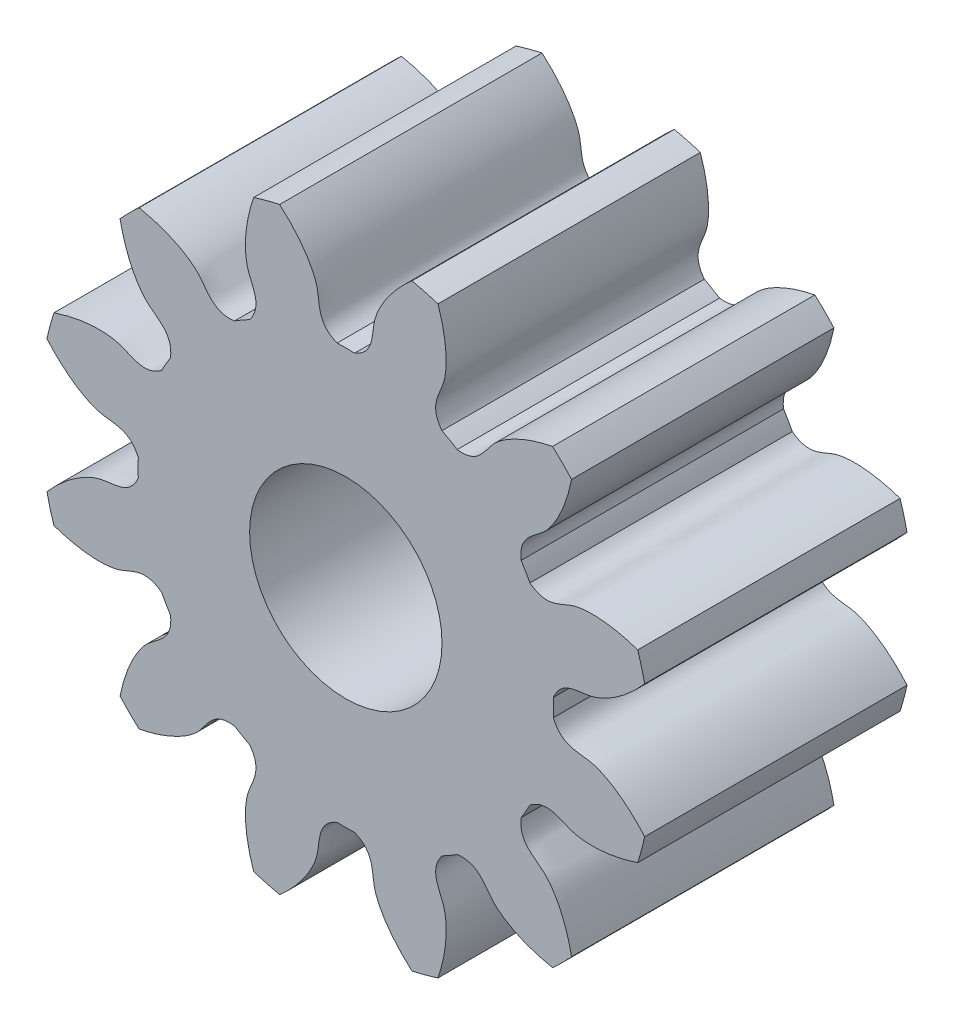
from build123d import *

# Parameters (mm, degrees)
SKETCH_1_R               = 3.5
EXTRUDE_1_DEPTH          = 3
CUT_EXTRUDE_1_DEPTH      = 6.787918451
PATTERN_CIRCULAR_1_COUNT = 12
CUT_EXTRUDE_2_REACH      = 7.688
SKETCH_5_R               = 1.1


with BuildPart() as part:
    # 草图1 → 凸台-拉伸1 (new body)
    with BuildSketch(Plane.XY):
        Circle(SKETCH_1_R)
    extrude(amount=EXTRUDE_1_DEPTH)

    # 草图2 → 切除-拉伸1 (cut, through all)
    with BuildSketch(Plane.XY):
        with BuildLine():
            ThreePointArc((0.100420056, 2.372876063), (0, 2.375), (-0.100420056, 2.372876063))
            add(Edge.make_bspline(
                [(-0.100420056, 2.372876063), (-0.340394435, 2.474653731), (-0.287186739, 2.672409341), (-0.338076094, 2.844740289), (-0.341311927, 2.854952869), (-0.345113625, 2.866166713), (-0.349521434, 2.878363044), (-0.354576313, 2.891521619), (-0.360318258, 2.905621034), (-0.36678678, 2.920638648), (-0.374020716, 2.936550626), (-0.382058239, 2.95333195), (-0.390936819, 2.970956436), (-0.400693193, 2.989396753), (-0.411363332, 3.008624444), (-0.422982412, 3.02860994), (-0.435584786, 3.049322589), (-0.449203949, 3.07073067), (-0.463872517, 3.092801417), (-0.479622192, 3.115501045), (-0.496483738, 3.138794769), (-0.514486952, 3.162646832), (-0.533660639, 3.187020528), (-0.554032585, 3.211878226), (-0.575629533, 3.237181399), (-0.598477155, 3.262890651), (-0.622600033, 3.288965742), (-0.648021632, 3.315365616), (-0.674764279, 3.342048434), (-0.702849139, 3.368971597), (-0.732296196, 3.396091781), (-0.763124233, 3.423364967), (-0.795350811, 3.450746465), (-0.828992247, 3.478190957), (-0.864063604, 3.505652518), (-0.900578664, 3.533084654), (-0.938549918, 3.560440334), (-0.977988547, 3.587672024), (-1.01890441, 3.614731718), (-1.061306025, 3.641570973), (-1.10520056, 3.668140947), (-1.150593819, 3.694392428), (-1.197490231, 3.720275872), (-1.245892835, 3.74574144), (-1.295803277, 3.770739031), (-1.347221796, 3.79521832), (-1.400147219, 3.819128792), (-1.454576948, 3.842419781), (-1.510506963, 3.865040505), (-1.567931802, 3.886940103), (-1.647189853, 3.915363979), (-1.7077968, 3.935050704), (-1.748802701, 3.947485455)],
                knots=[0, 0, 0, 0, 0.218015236, 0.222043642, 0.226545979, 0.231522246, 0.236972443, 0.24289657, 0.249294627, 0.256166614, 0.263512532, 0.271332379, 0.279626157, 0.288393865, 0.297635503, 0.307351072, 0.31754057, 0.328203999, 0.339341357, 0.350952646, 0.363037866, 0.375597015, 0.388630094, 0.402137104, 0.416118043, 0.430572913, 0.445501713, 0.460904444, 0.476781104, 0.493131694, 0.509956215, 0.527254666, 0.545027047, 0.563273358, 0.581993599, 0.601187771, 0.620855872, 0.640997904, 0.661613866, 0.682703758, 0.704267581, 0.726305333, 0.748817015, 0.771802628, 0.795262171, 0.819195644, 0.843603047, 0.868484381, 0.893839644, 0.919668838, 0.945971962, 1, 1, 1, 1], degree=3))
            ThreePointArc((-1.748802701, 3.947485455), (0, 4.317516914), (1.748802701, 3.947485455))
            add(Edge.make_bspline(
                [(0.100420056, 2.372876063), (0.340394435, 2.474653731), (0.287186739, 2.672409341), (0.338076094, 2.844740289), (0.341311927, 2.854952869), (0.345113625, 2.866166713), (0.349521434, 2.878363044), (0.354576313, 2.891521619), (0.360318258, 2.905621034), (0.36678678, 2.920638648), (0.374020716, 2.936550626), (0.382058239, 2.95333195), (0.390936819, 2.970956436), (0.400693193, 2.989396753), (0.411363332, 3.008624444), (0.422982412, 3.02860994), (0.435584786, 3.049322589), (0.449203949, 3.07073067), (0.463872517, 3.092801417), (0.479622192, 3.115501045), (0.496483738, 3.138794769), (0.514486952, 3.162646832), (0.533660639, 3.187020528), (0.554032585, 3.211878226), (0.575629533, 3.237181399), (0.598477155, 3.262890651), (0.622600033, 3.288965742), (0.648021632, 3.315365616), (0.674764279, 3.342048434), (0.702849139, 3.368971597), (0.732296196, 3.396091781), (0.763124233, 3.423364967), (0.795350811, 3.450746465), (0.828992247, 3.478190957), (0.864063604, 3.505652518), (0.900578664, 3.533084654), (0.938549918, 3.560440334), (0.977988547, 3.587672024), (1.01890441, 3.614731718), (1.061306025, 3.641570973), (1.10520056, 3.668140947), (1.150593819, 3.694392428), (1.197490231, 3.720275872), (1.245892835, 3.74574144), (1.295803277, 3.770739031), (1.347221796, 3.79521832), (1.400147219, 3.819128792), (1.454576948, 3.842419781), (1.510506963, 3.865040505), (1.567931802, 3.886940103), (1.647189853, 3.915363979), (1.7077968, 3.935050704), (1.748802701, 3.947485455)],
                knots=[0, 0, 0, 0, 0.218015236, 0.222043642, 0.226545979, 0.231522246, 0.236972443, 0.24289657, 0.249294627, 0.256166614, 0.263512532, 0.271332379, 0.279626157, 0.288393865, 0.297635503, 0.307351072, 0.31754057, 0.328203999, 0.339341357, 0.350952646, 0.363037866, 0.375597015, 0.388630094, 0.402137104, 0.416118043, 0.430572913, 0.445501713, 0.460904444, 0.476781104, 0.493131694, 0.509956215, 0.527254666, 0.545027047, 0.563273358, 0.581993599, 0.601187771, 0.620855872, 0.640997904, 0.661613866, 0.682703758, 0.704267581, 0.726305333, 0.748817015, 0.771802628, 0.795262171, 0.819195644, 0.843603047, 0.868484381, 0.893839644, 0.919668838, 0.945971962, 1, 1, 1, 1], degree=3))
        make_face()
    cut_extrude_1 = extrude(amount=CUT_EXTRUDE_1_DEPTH, mode=Mode.SUBTRACT)

    # 阵列(圆周)1: 切除-拉伸1 ×12 about axis
    pattern_circular_1_axis = Axis((0, 0, 3), (0, 0, -1))
    for i in range(1, PATTERN_CIRCULAR_1_COUNT):
        add(cut_extrude_1.rotate(pattern_circular_1_axis, i * 360 / PATTERN_CIRCULAR_1_COUNT), mode=Mode.SUBTRACT)

    # 草图5 → 切除-拉伸2 (cut, up to next)
    with BuildSketch(Plane.XY.offset(3), mode=Mode.PRIVATE) as cut_extrude_2_sk1:
        Circle(SKETCH_5_R)
    cut_extrude_2_tool1 = extrude(cut_extrude_2_sk1.sketch, amount=-CUT_EXTRUDE_2_REACH, mode=Mode.PRIVATE) & part.part
    add(cut_extrude_2_tool1.solids().sort_by_distance((0, 0, 3))[0], mode=Mode.SUBTRACT)


solid = part.part
